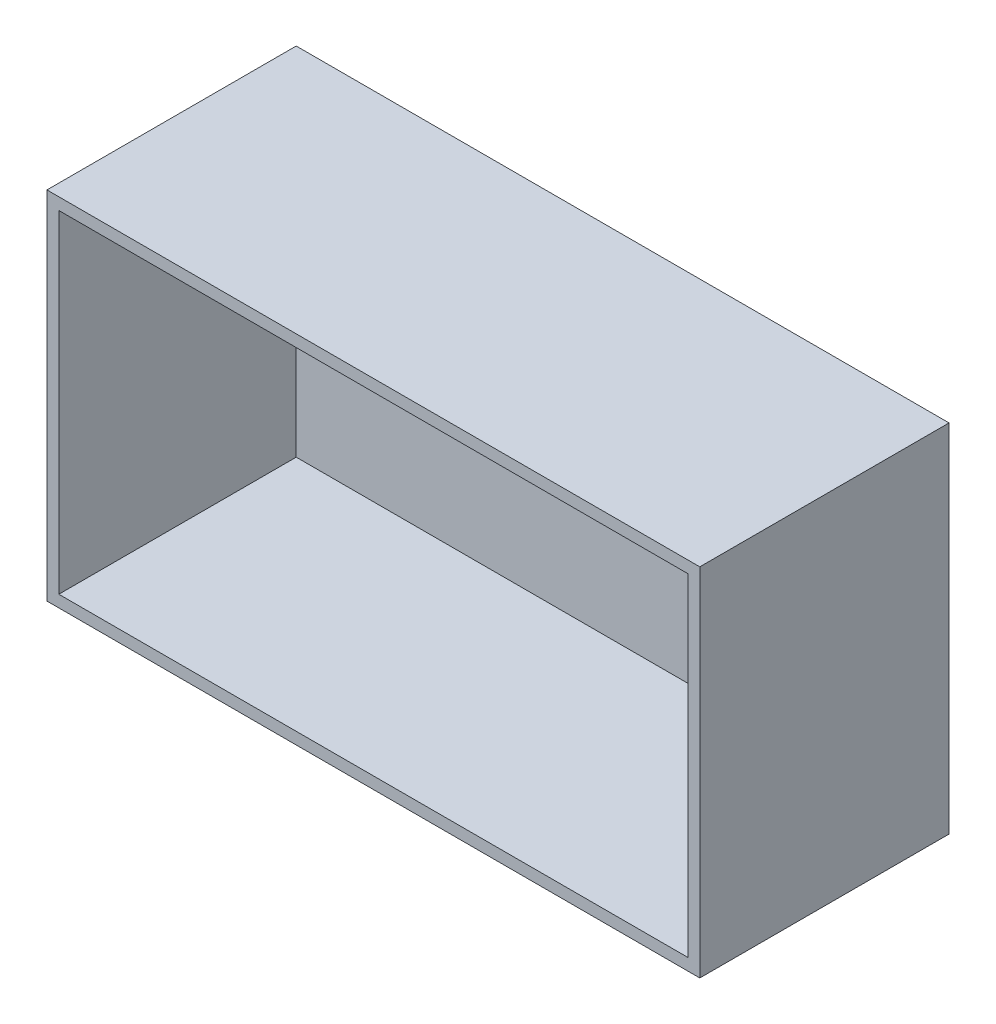
from build123d import *

# Parameters (mm, degrees)
SKETCH_1_W      = 110
SKETCH_1_H      = 60
EXTRUDE_1_DEPTH = 2
SKETCH_2_W      = 110
SKETCH_2_H      = 60
SKETCH_2_W_2    = 106
SKETCH_2_H_2    = 56
EXTRUDE_2_DEPTH = 40


with BuildPart() as part:
    # 草图1 → 凸台-拉伸1 (new body)
    with BuildSketch(Plane.XY):
        with Locations((55, 30)):
            Rectangle(SKETCH_1_W, SKETCH_1_H)
    extrude(amount=EXTRUDE_1_DEPTH)

    # 草图2 → 凸台-拉伸2 (add)
    with BuildSketch(Plane.XY.offset(2)):
        with Locations((55, 30)):
            Rectangle(SKETCH_2_W, SKETCH_2_H)
        with Locations((55, 30)):
            Rectangle(SKETCH_2_W_2, SKETCH_2_H_2, mode=Mode.SUBTRACT)
    extrude(amount=EXTRUDE_2_DEPTH)


solid = part.part
